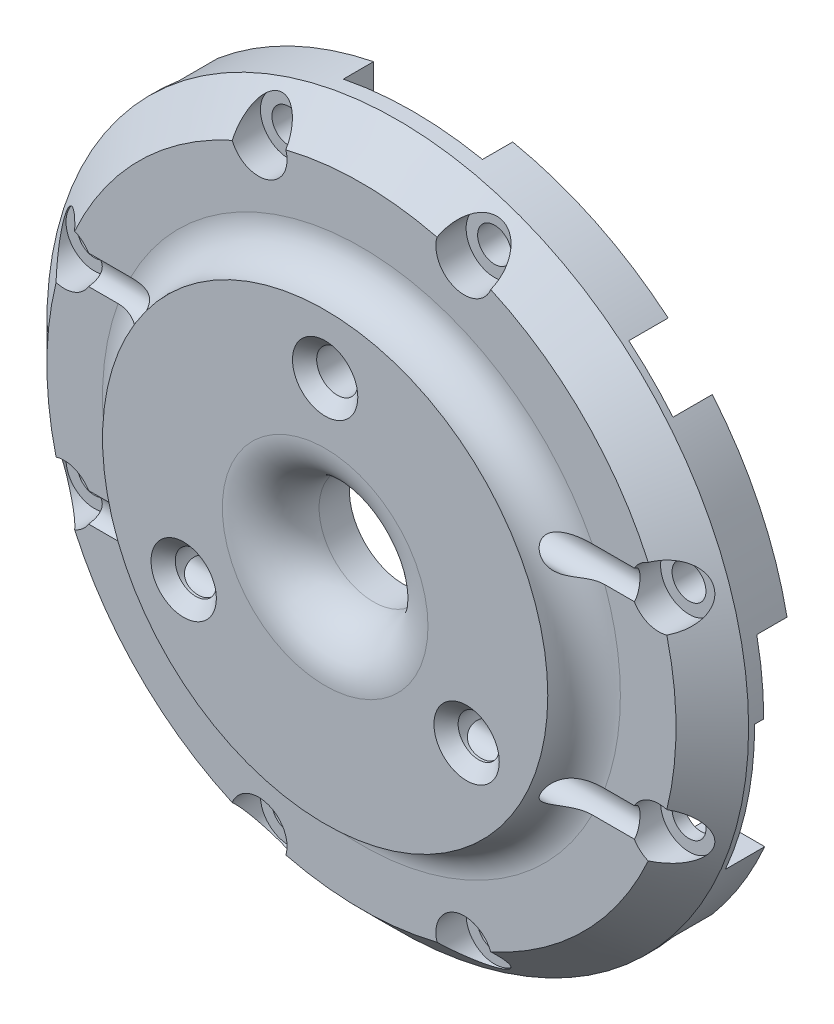
from build123d import *

# Parameters (mm, degrees)
SKETCH1_R               = 29
BOSS_EXTRUDE1_DEPTH     = 6.75
SKETCH3_W               = 44.5
SKETCH3_H               = 44.5
CUT_EXTRUDE1_DEPTH      = 3.25
SKETCH4_R               = 18.4
BOSS_EXTRUDE2_DEPTH     = 3
FILLET1_R               = 3
SKETCH5_R               = 1.7
CUT_EXTRUDE2_DEPTH      = 43.155219131
SKETCH7_R               = 3.25
CUT_EXTRUDE3_DEPTH      = 2
CHAMFER2_SIZE           = 3
CUT_EXTRUDE5_DEPTH      = 43.155219131
CUT_EXTRUDE5_DEPTH_BACK = 43.155219131
SKETCH9_R               = 1.3
SKETCH10_W              = 11.5
SKETCH10_H              = 12.03351403
SKETCH10_W_2            = 12.03351403
SKETCH10_H_2            = 11.5
CUT_EXTRUDE6_DEPTH      = 2.5
SKETCH11_R              = 1.4
CUT_EXTRUDE7_DEPTH      = 43.155219292
SKETCH12_R              = 2.35
CUT_EXTRUDE8_DEPTH      = 2.5
SKETCH13_W              = 6.5
SKETCH13_H              = 6.5
CUT_EXTRUDE9_DEPTH      = 2.25
SKETCH14_W              = 15.887507813
SKETCH14_H              = 11.6
CUT_EXTRUDE10_DEPTH     = 3.25
FILLET2_R               = 1.5
SKETCH16_R              = 4.5
CUT_EXTRUDE11_DEPTH     = 43.155219269
FILLET3_R               = 4
CHAMFER6_SIZE           = 1


# Some blends are built 0.0001 mm under size
with BuildPart() as part:
    # Sketch1 → Boss-Extrude1 (new body)
    with BuildSketch(Plane.XY):
        Circle(SKETCH1_R)
    extrude(amount=BOSS_EXTRUDE1_DEPTH)

    # Sketch3 → Cut-Extrude1 (cut)
    with BuildSketch(Plane(origin=(0, 0, 0), x_dir=(-1, 0, 0), z_dir=(0, 0, -1))):
        Rectangle(SKETCH3_W, SKETCH3_H)
    extrude(amount=-CUT_EXTRUDE1_DEPTH, mode=Mode.SUBTRACT)

    # Sketch4 → Boss-Extrude2 (add)
    with BuildSketch(Plane.XY.offset(6.75)):
        Circle(SKETCH4_R)
    extrude(amount=BOSS_EXTRUDE2_DEPTH)

    # Fillet1
    fillet1_edges = [part.edges().sort_by_distance(p)[0] for p in [
        (-18.4, 0, 6.75),
    ]]
    fillet(fillet1_edges, radius=FILLET1_R - 0.0001)  # a hair under: the kernel refuses the full size

    # Sketch5 → Cut-Extrude2 (cut, through all)
    with BuildSketch(Plane.XY.offset(9.75)):
        with Locations((0, 13.5)):
            Circle(SKETCH5_R)
        with Locations((11.691342951, -6.75)):
            Circle(SKETCH5_R)
        with Locations((-11.691342951, -6.75)):
            Circle(SKETCH5_R)
    extrude(amount=-CUT_EXTRUDE2_DEPTH, mode=Mode.SUBTRACT)

    # Sketch7 → Cut-Extrude3 (cut)
    with BuildSketch(Plane(origin=(0, 0, 3.25), x_dir=(-1, 0, 0), z_dir=(0, 0, -1))):
        with Locations((-11.691342951, -6.75)):
            Circle(SKETCH7_R)
        with Locations((11.691342951, -6.75)):
            Circle(SKETCH7_R)
        with Locations((0, 13.5)):
            Circle(SKETCH7_R)
    extrude(amount=-CUT_EXTRUDE3_DEPTH, mode=Mode.SUBTRACT)

    # Chamfer2
    chamfer2_edges = [part.edges().sort_by_distance(p)[0] for p in [
        (-29, 0, 6.75),
    ]]
    chamfer(chamfer2_edges, length=CHAMFER2_SIZE)

    # Sketch9 → Cut-Extrude5 (cut, two sides: drawn at the far end of the back side and taken through both)
    with BuildSketch(Plane(origin=(0, 0, 0), x_dir=(0, 0, -1), z_dir=(1, 0, 0)).offset(-CUT_EXTRUDE5_DEPTH_BACK)):
        with Locations(Location((-7.25, 8.5, 0), (0, 0, 67.380135052))):
            Circle(SKETCH9_R)
        with Locations(Location((-7.25, -8.5, 0), (0, 0, 292.619864948))):
            Circle(SKETCH9_R)
    extrude(amount=CUT_EXTRUDE5_DEPTH + CUT_EXTRUDE5_DEPTH_BACK, mode=Mode.SUBTRACT)

    # Sketch10 → Cut-Extrude6 (cut)
    with BuildSketch(Plane(origin=(0, 0, 0), x_dir=(-1, 0, 0), z_dir=(0, 0, -1))):
        with Locations((0, -28.01742408)):
            Rectangle(SKETCH10_W, SKETCH10_H)
        with Locations((28.01742408, 0)):
            Rectangle(SKETCH10_W_2, SKETCH10_H_2)
        with Locations((-28.01742408, 0)):
            Rectangle(SKETCH10_W_2, SKETCH10_H_2)
        with Locations((0, 28.01742408)):
            Rectangle(SKETCH10_W, SKETCH10_H)
    extrude(amount=-CUT_EXTRUDE6_DEPTH, mode=Mode.SUBTRACT)

    # Sketch11 → Cut-Extrude7 (cut, through all)
    with BuildSketch(Plane(origin=(0, 0, 0), x_dir=(-1, 0, 0), z_dir=(0, 0, -1))):
        with Locations((-24.571324751, 8.5)):
            Circle(SKETCH11_R)
        with Locations(Location((-24.571324751, -8.5, 0), (0, 0, 301.002719134))):
            Circle(SKETCH11_R)
        with Locations(Location((-8.5, 24.571324751, 0), (0, 0, 17.539359707))):
            Circle(SKETCH11_R)
        with Locations((8.5, 24.571324751)):
            Circle(SKETCH11_R)
        with Locations(Location((24.571324751, 8.5, 0), (0, 0, 287.539359707))):
            Circle(SKETCH11_R)
        with Locations((24.571324751, -8.5)):
            Circle(SKETCH11_R)
        with Locations(Location((8.5, -24.571324751, 0), (0, 0, 20.624890048))):
            Circle(SKETCH11_R)
        with Locations((-8.5, -24.571324751)):
            Circle(SKETCH11_R)
    extrude(amount=-CUT_EXTRUDE7_DEPTH, mode=Mode.SUBTRACT)

    # Sketch12 → Cut-Extrude8 (cut)
    with BuildSketch(Plane.XY.offset(6.75)):
        with Locations((-24.571324751, 8.5)):
            Circle(SKETCH12_R)
        with Locations((-24.571324751, -8.5)):
            Circle(SKETCH12_R)
        with Locations((8.5, 24.571324751)):
            Circle(SKETCH12_R)
        with Locations((-8.5, 24.571324751)):
            Circle(SKETCH12_R)
        with Locations((24.571324751, -8.5)):
            Circle(SKETCH12_R)
        with Locations((24.571324751, 8.5)):
            Circle(SKETCH12_R)
        with Locations((-8.5, -24.571324751)):
            Circle(SKETCH12_R)
        with Locations((8.5, -24.571324751)):
            Circle(SKETCH12_R)
    extrude(amount=-CUT_EXTRUDE8_DEPTH, mode=Mode.SUBTRACT)

    # Sketch13 → Cut-Extrude9 (cut)
    with BuildSketch(Plane(origin=(0, 0, 3.25), x_dir=(-1, 0, 0), z_dir=(0, 0, -1))):
        with Locations((-18.9, 11.5)):
            Rectangle(SKETCH13_W, SKETCH13_H)
        with Locations((11.5, 18.9)):
            Rectangle(SKETCH13_W, SKETCH13_H)
        with Locations((18.9, -11.5)):
            Rectangle(SKETCH13_W, SKETCH13_H)
        with Locations((-11.5, -18.9)):
            Rectangle(SKETCH13_W, SKETCH13_H)
    extrude(amount=-CUT_EXTRUDE9_DEPTH, mode=Mode.SUBTRACT)

    # Chamfer5
    # the kernel refuses this chamfer: 1 mm, written as the material it takes off along each edge
    with BuildSketch(Plane(origin=(15.65, 8.25, 3.25), x_dir=(0, -0.9996219169112968, -0.027495876610586487), z_dir=(1, 0, 0)), Plane(origin=(15.65, 14.75, 3.25), x_dir=(-0.9996219169112968, 0, -0.02749587661058651), z_dir=(0, -1, 0)), Plane(origin=(22.15, 14.75, 3.25), x_dir=(0, 0.9996219169112968, -0.02749587661058651), z_dir=(-1, 0, 0)), Plane(origin=(-8.25, 15.65, 3.25), x_dir=(0.9996219169112968, 0, -0.027495876610586487), z_dir=(0, 1, 0)), Plane(origin=(-14.75, 15.65, 3.25), x_dir=(0, -0.9996219169112968, -0.02749587661058651), z_dir=(1, 0, 0)), Plane(origin=(-14.75, 22.15, 3.25), x_dir=(-0.9996219169112968, 0, -0.02749587661058651), z_dir=(0, -1, 0)), Plane(origin=(-15.65, -8.25, 3.25), x_dir=(0, 0.9996219169112968, -0.027495876610586487), z_dir=(-1, 0, 0)), Plane(origin=(-15.65, -14.75, 3.25), x_dir=(0.9996219169112968, 0, -0.02749587661058651), z_dir=(0, 1, 0)), Plane(origin=(-22.15, -14.75, 3.25), x_dir=(0, -0.9996219169112968, -0.02749587661058651), z_dir=(1, 0, 0)), Plane(origin=(8.25, -15.65, 3.25), x_dir=(-0.9996219169112968, 0, -0.027495876610586487), z_dir=(0, -1, 0)), Plane(origin=(14.75, -15.65, 3.25), x_dir=(0, 0.9996219169112968, -0.02749587661058651), z_dir=(-1, 0, 0)), Plane(origin=(14.75, -22.15, 3.25), x_dir=(0.9996219169112968, 0, -0.02749587661058651), z_dir=(0, 1, 0))) as chamfer5_piece_1:
        with BuildLine():
            Line((1.028673195, 0), (-0.056547155, -1.027117794))
            Line((-0.056547155, -1.027117794), (-0.076539593, -1.026567876))
            ThreePointArc((-0.076539593, -1.026567876), (-0.034129227, -0.51339783), (-0.019992438, 0.000549918))
            Line((-0.019992438, 0.000549918), (0.000549918, 0.019992438))
            ThreePointArc((0.000549918, 0.019992438), (0.514497665, 0.00585565), (1.029223113, 0.019992438))
            Line((1.029223113, 0.019992438), (1.028673195, 0))
        make_face()
    extrude(amount=6.5, mode=Mode.SUBTRACT)
    with BuildSketch(Plane(origin=(13.078317012, 8.25, 3.25), x_dir=(0, -0.9996219169112968, -0.027495876610586487), z_dir=(1, 0, 0))) as chamfer5_piece_2a_section:
        with BuildLine():
            Line((1.028673195, 0), (-0.056547155, -1.027117794))
            Line((-0.056547155, -1.027117794), (-0.076539593, -1.026567876))
            ThreePointArc((-0.076539593, -1.026567876), (-0.034129227, -0.51339783), (-0.019992438, 0.000549918))
            Line((-0.019992438, 0.000549918), (0.000549918, 0.019992438))
            ThreePointArc((0.000549918, 0.019992438), (0.514497665, 0.00585565), (1.029223113, 0.019992438))
            Line((1.029223113, 0.019992438), (1.028673195, 0))
        make_face()
    chamfer5_piece_2a = extrude(amount=9.071682988, mode=Mode.PRIVATE)
    chamfer5_piece_2a = split(chamfer5_piece_2a, bisect_by=Plane(origin=(15.65, 7.920206373, 3.579793627), z_dir=(-1, 0, 0)), keep=Keep.TOP, mode=Mode.PRIVATE)
    with BuildSketch(Plane(origin=(15.65, 14.75, 3.25), x_dir=(-0.9996219169112968, 0, -0.02749587661058651), z_dir=(0, -1, 0))) as chamfer5_piece_2b_section:
        with BuildLine():
            Line((1.028673195, 0), (-0.056547155, -1.027117794))
            Line((-0.056547155, -1.027117794), (-0.076539593, -1.026567876))
            ThreePointArc((-0.076539593, -1.026567876), (-0.034129227, -0.51339783), (-0.019992438, 0.000549918))
            Line((-0.019992438, 0.000549918), (0.000549918, 0.019992438))
            ThreePointArc((0.000549918, 0.019992438), (0.514497665, 0.00585565), (1.029223113, 0.019992438))
            Line((1.029223113, 0.019992438), (1.028673195, 0))
        make_face()
    chamfer5_piece_2b = extrude(amount=9.071682988, mode=Mode.PRIVATE)
    chamfer5_piece_2b = split(chamfer5_piece_2b, bisect_by=Plane(origin=(15.320206373, 8.25, 3.579793627), z_dir=(0, -1, 0)), keep=Keep.TOP, mode=Mode.PRIVATE)
    chamfer5_piece_2 = chamfer5_piece_2a & chamfer5_piece_2b
    add(chamfer5_piece_2, mode=Mode.SUBTRACT)
    with BuildSketch(Plane(origin=(15.65, 17.321682988, 3.25), x_dir=(-0.9996219169112968, 0, -0.02749587661058651), z_dir=(0, -1, 0))) as chamfer5_piece_3a_section:
        with BuildLine():
            Line((1.028673195, 0), (-0.056547155, -1.027117794))
            Line((-0.056547155, -1.027117794), (-0.076539593, -1.026567876))
            ThreePointArc((-0.076539593, -1.026567876), (-0.034129227, -0.51339783), (-0.019992438, 0.000549918))
            Line((-0.019992438, 0.000549918), (0.000549918, 0.019992438))
            ThreePointArc((0.000549918, 0.019992438), (0.514497665, 0.00585565), (1.029223113, 0.019992438))
            Line((1.029223113, 0.019992438), (1.028673195, 0))
        make_face()
    chamfer5_piece_3a = extrude(amount=9.071682988, mode=Mode.PRIVATE)
    chamfer5_piece_3a = split(chamfer5_piece_3a, bisect_by=Plane(origin=(15.320206373, 14.75, 3.579793627), z_dir=(0, 1, 0)), keep=Keep.TOP, mode=Mode.PRIVATE)
    with BuildSketch(Plane(origin=(22.15, 14.75, 3.25), x_dir=(0, 0.9996219169112968, -0.02749587661058651), z_dir=(-1, 0, 0))) as chamfer5_piece_3b_section:
        with BuildLine():
            Line((1.028673195, 0), (-0.056547155, -1.027117794))
            Line((-0.056547155, -1.027117794), (-0.076539593, -1.026567876))
            ThreePointArc((-0.076539593, -1.026567876), (-0.034129227, -0.51339783), (-0.019992438, 0.000549918))
            Line((-0.019992438, 0.000549918), (0.000549918, 0.019992438))
            ThreePointArc((0.000549918, 0.019992438), (0.514497665, 0.00585565), (1.029223113, 0.019992438))
            Line((1.029223113, 0.019992438), (1.028673195, 0))
        make_face()
    chamfer5_piece_3b = extrude(amount=9.071682988, mode=Mode.PRIVATE)
    chamfer5_piece_3b = split(chamfer5_piece_3b, bisect_by=Plane(origin=(15.65, 15.079793627, 3.579793627), z_dir=(-1, 0, 0)), keep=Keep.TOP, mode=Mode.PRIVATE)
    chamfer5_piece_3 = chamfer5_piece_3a & chamfer5_piece_3b
    add(chamfer5_piece_3, mode=Mode.SUBTRACT)
    with BuildSketch(Plane(origin=(-8.25, 13.078317012, 3.25), x_dir=(0.9996219169112968, 0, -0.027495876610586487), z_dir=(0, 1, 0))) as chamfer5_piece_4a_section:
        with BuildLine():
            Line((1.028673195, 0), (-0.056547155, -1.027117794))
            Line((-0.056547155, -1.027117794), (-0.076539593, -1.026567876))
            ThreePointArc((-0.076539593, -1.026567876), (-0.034129227, -0.51339783), (-0.019992438, 0.000549918))
            Line((-0.019992438, 0.000549918), (0.000549918, 0.019992438))
            ThreePointArc((0.000549918, 0.019992438), (0.514497665, 0.00585565), (1.029223113, 0.019992438))
            Line((1.029223113, 0.019992438), (1.028673195, 0))
        make_face()
    chamfer5_piece_4a = extrude(amount=9.071682988, mode=Mode.PRIVATE)
    chamfer5_piece_4a = split(chamfer5_piece_4a, bisect_by=Plane(origin=(-7.920206373, 15.65, 3.579793627), z_dir=(0, -1, 0)), keep=Keep.TOP, mode=Mode.PRIVATE)
    with BuildSketch(Plane(origin=(-14.75, 15.65, 3.25), x_dir=(0, -0.9996219169112968, -0.02749587661058651), z_dir=(1, 0, 0))) as chamfer5_piece_4b_section:
        with BuildLine():
            Line((1.028673195, 0), (-0.056547155, -1.027117794))
            Line((-0.056547155, -1.027117794), (-0.076539593, -1.026567876))
            ThreePointArc((-0.076539593, -1.026567876), (-0.034129227, -0.51339783), (-0.019992438, 0.000549918))
            Line((-0.019992438, 0.000549918), (0.000549918, 0.019992438))
            ThreePointArc((0.000549918, 0.019992438), (0.514497665, 0.00585565), (1.029223113, 0.019992438))
            Line((1.029223113, 0.019992438), (1.028673195, 0))
        make_face()
    chamfer5_piece_4b = extrude(amount=9.071682988, mode=Mode.PRIVATE)
    chamfer5_piece_4b = split(chamfer5_piece_4b, bisect_by=Plane(origin=(-8.25, 15.320206373, 3.579793627), z_dir=(1, 0, 0)), keep=Keep.TOP, mode=Mode.PRIVATE)
    chamfer5_piece_4 = chamfer5_piece_4a & chamfer5_piece_4b
    add(chamfer5_piece_4, mode=Mode.SUBTRACT)
    with BuildSketch(Plane(origin=(-17.321682988, 15.65, 3.25), x_dir=(0, -0.9996219169112968, -0.02749587661058651), z_dir=(1, 0, 0))) as chamfer5_piece_5a_section:
        with BuildLine():
            Line((1.028673195, 0), (-0.056547155, -1.027117794))
            Line((-0.056547155, -1.027117794), (-0.076539593, -1.026567876))
            ThreePointArc((-0.076539593, -1.026567876), (-0.034129227, -0.51339783), (-0.019992438, 0.000549918))
            Line((-0.019992438, 0.000549918), (0.000549918, 0.019992438))
            ThreePointArc((0.000549918, 0.019992438), (0.514497665, 0.00585565), (1.029223113, 0.019992438))
            Line((1.029223113, 0.019992438), (1.028673195, 0))
        make_face()
    chamfer5_piece_5a = extrude(amount=9.071682988, mode=Mode.PRIVATE)
    chamfer5_piece_5a = split(chamfer5_piece_5a, bisect_by=Plane(origin=(-14.75, 15.320206373, 3.579793627), z_dir=(-1, 0, 0)), keep=Keep.TOP, mode=Mode.PRIVATE)
    with BuildSketch(Plane(origin=(-14.75, 22.15, 3.25), x_dir=(-0.9996219169112968, 0, -0.02749587661058651), z_dir=(0, -1, 0))) as chamfer5_piece_5b_section:
        with BuildLine():
            Line((1.028673195, 0), (-0.056547155, -1.027117794))
            Line((-0.056547155, -1.027117794), (-0.076539593, -1.026567876))
            ThreePointArc((-0.076539593, -1.026567876), (-0.034129227, -0.51339783), (-0.019992438, 0.000549918))
            Line((-0.019992438, 0.000549918), (0.000549918, 0.019992438))
            ThreePointArc((0.000549918, 0.019992438), (0.514497665, 0.00585565), (1.029223113, 0.019992438))
            Line((1.029223113, 0.019992438), (1.028673195, 0))
        make_face()
    chamfer5_piece_5b = extrude(amount=9.071682988, mode=Mode.PRIVATE)
    chamfer5_piece_5b = split(chamfer5_piece_5b, bisect_by=Plane(origin=(-15.079793627, 15.65, 3.579793627), z_dir=(0, -1, 0)), keep=Keep.TOP, mode=Mode.PRIVATE)
    chamfer5_piece_5 = chamfer5_piece_5a & chamfer5_piece_5b
    add(chamfer5_piece_5, mode=Mode.SUBTRACT)
    with BuildSketch(Plane(origin=(-13.078317012, -8.25, 3.25), x_dir=(0, 0.9996219169112968, -0.027495876610586487), z_dir=(-1, 0, 0))) as chamfer5_piece_6a_section:
        with BuildLine():
            Line((1.028673195, 0), (-0.056547155, -1.027117794))
            Line((-0.056547155, -1.027117794), (-0.076539593, -1.026567876))
            ThreePointArc((-0.076539593, -1.026567876), (-0.034129227, -0.51339783), (-0.019992438, 0.000549918))
            Line((-0.019992438, 0.000549918), (0.000549918, 0.019992438))
            ThreePointArc((0.000549918, 0.019992438), (0.514497665, 0.00585565), (1.029223113, 0.019992438))
            Line((1.029223113, 0.019992438), (1.028673195, 0))
        make_face()
    chamfer5_piece_6a = extrude(amount=9.071682988, mode=Mode.PRIVATE)
    chamfer5_piece_6a = split(chamfer5_piece_6a, bisect_by=Plane(origin=(-15.65, -7.920206373, 3.579793627), z_dir=(1, 0, 0)), keep=Keep.TOP, mode=Mode.PRIVATE)
    with BuildSketch(Plane(origin=(-15.65, -14.75, 3.25), x_dir=(0.9996219169112968, 0, -0.02749587661058651), z_dir=(0, 1, 0))) as chamfer5_piece_6b_section:
        with BuildLine():
            Line((1.028673195, 0), (-0.056547155, -1.027117794))
            Line((-0.056547155, -1.027117794), (-0.076539593, -1.026567876))
            ThreePointArc((-0.076539593, -1.026567876), (-0.034129227, -0.51339783), (-0.019992438, 0.000549918))
            Line((-0.019992438, 0.000549918), (0.000549918, 0.019992438))
            ThreePointArc((0.000549918, 0.019992438), (0.514497665, 0.00585565), (1.029223113, 0.019992438))
            Line((1.029223113, 0.019992438), (1.028673195, 0))
        make_face()
    chamfer5_piece_6b = extrude(amount=9.071682988, mode=Mode.PRIVATE)
    chamfer5_piece_6b = split(chamfer5_piece_6b, bisect_by=Plane(origin=(-15.320206373, -8.25, 3.579793627), z_dir=(0, 1, 0)), keep=Keep.TOP, mode=Mode.PRIVATE)
    chamfer5_piece_6 = chamfer5_piece_6a & chamfer5_piece_6b
    add(chamfer5_piece_6, mode=Mode.SUBTRACT)
    with BuildSketch(Plane(origin=(-15.65, -17.321682988, 3.25), x_dir=(0.9996219169112968, 0, -0.02749587661058651), z_dir=(0, 1, 0))) as chamfer5_piece_7a_section:
        with BuildLine():
            Line((1.028673195, 0), (-0.056547155, -1.027117794))
            Line((-0.056547155, -1.027117794), (-0.076539593, -1.026567876))
            ThreePointArc((-0.076539593, -1.026567876), (-0.034129227, -0.51339783), (-0.019992438, 0.000549918))
            Line((-0.019992438, 0.000549918), (0.000549918, 0.019992438))
            ThreePointArc((0.000549918, 0.019992438), (0.514497665, 0.00585565), (1.029223113, 0.019992438))
            Line((1.029223113, 0.019992438), (1.028673195, 0))
        make_face()
    chamfer5_piece_7a = extrude(amount=9.071682988, mode=Mode.PRIVATE)
    chamfer5_piece_7a = split(chamfer5_piece_7a, bisect_by=Plane(origin=(-15.320206373, -14.75, 3.579793627), z_dir=(0, -1, 0)), keep=Keep.TOP, mode=Mode.PRIVATE)
    with BuildSketch(Plane(origin=(-22.15, -14.75, 3.25), x_dir=(0, -0.9996219169112968, -0.02749587661058651), z_dir=(1, 0, 0))) as chamfer5_piece_7b_section:
        with BuildLine():
            Line((1.028673195, 0), (-0.056547155, -1.027117794))
            Line((-0.056547155, -1.027117794), (-0.076539593, -1.026567876))
            ThreePointArc((-0.076539593, -1.026567876), (-0.034129227, -0.51339783), (-0.019992438, 0.000549918))
            Line((-0.019992438, 0.000549918), (0.000549918, 0.019992438))
            ThreePointArc((0.000549918, 0.019992438), (0.514497665, 0.00585565), (1.029223113, 0.019992438))
            Line((1.029223113, 0.019992438), (1.028673195, 0))
        make_face()
    chamfer5_piece_7b = extrude(amount=9.071682988, mode=Mode.PRIVATE)
    chamfer5_piece_7b = split(chamfer5_piece_7b, bisect_by=Plane(origin=(-15.65, -15.079793627, 3.579793627), z_dir=(1, 0, 0)), keep=Keep.TOP, mode=Mode.PRIVATE)
    chamfer5_piece_7 = chamfer5_piece_7a & chamfer5_piece_7b
    add(chamfer5_piece_7, mode=Mode.SUBTRACT)
    with BuildSketch(Plane(origin=(8.25, -13.078317012, 3.25), x_dir=(-0.9996219169112968, 0, -0.027495876610586487), z_dir=(0, -1, 0))) as chamfer5_piece_8a_section:
        with BuildLine():
            Line((1.028673195, 0), (-0.056547155, -1.027117794))
            Line((-0.056547155, -1.027117794), (-0.076539593, -1.026567876))
            ThreePointArc((-0.076539593, -1.026567876), (-0.034129227, -0.51339783), (-0.019992438, 0.000549918))
            Line((-0.019992438, 0.000549918), (0.000549918, 0.019992438))
            ThreePointArc((0.000549918, 0.019992438), (0.514497665, 0.00585565), (1.029223113, 0.019992438))
            Line((1.029223113, 0.019992438), (1.028673195, 0))
        make_face()
    chamfer5_piece_8a = extrude(amount=9.071682988, mode=Mode.PRIVATE)
    chamfer5_piece_8a = split(chamfer5_piece_8a, bisect_by=Plane(origin=(7.920206373, -15.65, 3.579793627), z_dir=(0, 1, 0)), keep=Keep.TOP, mode=Mode.PRIVATE)
    with BuildSketch(Plane(origin=(14.75, -15.65, 3.25), x_dir=(0, 0.9996219169112968, -0.02749587661058651), z_dir=(-1, 0, 0))) as chamfer5_piece_8b_section:
        with BuildLine():
            Line((1.028673195, 0), (-0.056547155, -1.027117794))
            Line((-0.056547155, -1.027117794), (-0.076539593, -1.026567876))
            ThreePointArc((-0.076539593, -1.026567876), (-0.034129227, -0.51339783), (-0.019992438, 0.000549918))
            Line((-0.019992438, 0.000549918), (0.000549918, 0.019992438))
            ThreePointArc((0.000549918, 0.019992438), (0.514497665, 0.00585565), (1.029223113, 0.019992438))
            Line((1.029223113, 0.019992438), (1.028673195, 0))
        make_face()
    chamfer5_piece_8b = extrude(amount=9.071682988, mode=Mode.PRIVATE)
    chamfer5_piece_8b = split(chamfer5_piece_8b, bisect_by=Plane(origin=(8.25, -15.320206373, 3.579793627), z_dir=(-1, 0, 0)), keep=Keep.TOP, mode=Mode.PRIVATE)
    chamfer5_piece_8 = chamfer5_piece_8a & chamfer5_piece_8b
    add(chamfer5_piece_8, mode=Mode.SUBTRACT)
    with BuildSketch(Plane(origin=(17.321682988, -15.65, 3.25), x_dir=(0, 0.9996219169112968, -0.02749587661058651), z_dir=(-1, 0, 0))) as chamfer5_piece_9a_section:
        with BuildLine():
            Line((1.028673195, 0), (-0.056547155, -1.027117794))
            Line((-0.056547155, -1.027117794), (-0.076539593, -1.026567876))
            ThreePointArc((-0.076539593, -1.026567876), (-0.034129227, -0.51339783), (-0.019992438, 0.000549918))
            Line((-0.019992438, 0.000549918), (0.000549918, 0.019992438))
            ThreePointArc((0.000549918, 0.019992438), (0.514497665, 0.00585565), (1.029223113, 0.019992438))
            Line((1.029223113, 0.019992438), (1.028673195, 0))
        make_face()
    chamfer5_piece_9a = extrude(amount=9.071682988, mode=Mode.PRIVATE)
    chamfer5_piece_9a = split(chamfer5_piece_9a, bisect_by=Plane(origin=(14.75, -15.320206373, 3.579793627), z_dir=(1, 0, 0)), keep=Keep.TOP, mode=Mode.PRIVATE)
    with BuildSketch(Plane(origin=(14.75, -22.15, 3.25), x_dir=(0.9996219169112968, 0, -0.02749587661058651), z_dir=(0, 1, 0))) as chamfer5_piece_9b_section:
        with BuildLine():
            Line((1.028673195, 0), (-0.056547155, -1.027117794))
            Line((-0.056547155, -1.027117794), (-0.076539593, -1.026567876))
            ThreePointArc((-0.076539593, -1.026567876), (-0.034129227, -0.51339783), (-0.019992438, 0.000549918))
            Line((-0.019992438, 0.000549918), (0.000549918, 0.019992438))
            ThreePointArc((0.000549918, 0.019992438), (0.514497665, 0.00585565), (1.029223113, 0.019992438))
            Line((1.029223113, 0.019992438), (1.028673195, 0))
        make_face()
    chamfer5_piece_9b = extrude(amount=9.071682988, mode=Mode.PRIVATE)
    chamfer5_piece_9b = split(chamfer5_piece_9b, bisect_by=Plane(origin=(15.079793627, -15.65, 3.579793627), z_dir=(0, 1, 0)), keep=Keep.TOP, mode=Mode.PRIVATE)
    chamfer5_piece_9 = chamfer5_piece_9a & chamfer5_piece_9b
    add(chamfer5_piece_9, mode=Mode.SUBTRACT)

    # Sketch14 → Cut-Extrude10 (cut)
    with BuildSketch(Plane(origin=(0, 0, 0), x_dir=(-1, 0, 0), z_dir=(0, 0, -1))):
        with Locations((-27.176000206, -5.8)):
            Rectangle(SKETCH14_W, SKETCH14_H)
    extrude(amount=-CUT_EXTRUDE10_DEPTH, mode=Mode.SUBTRACT)

    # Fillet2
    # the kernel refuses this fillet: 1.5 mm, written as the material it takes off along each edge
    with BuildSketch(Plane(origin=(-11.691342951, -6.75, 3.25), x_dir=(-1, 0, 0), z_dir=(0, -1, 0))) as fillet2_piece_1:
        with BuildLine():
            CenterArc((3.25 + FILLET2_R, -FILLET2_R), FILLET2_R, 90, 90)
            Line((3.25, -FILLET2_R), (3.25, 0))
            Line((3.25, 0), (3.25 + FILLET2_R, 0))
        make_face()
    revolve(axis=Axis((-11.691342951, -6.75, 3.25), (0, 0, -1)), revolution_arc=359.64, mode=Mode.SUBTRACT)
    with BuildSketch(Plane(origin=(11.691342951, -6.75, 3.25), x_dir=(-1, 0, 0), z_dir=(0, -1, 0))) as fillet2_piece_2:
        with BuildLine():
            CenterArc((3.25 + FILLET2_R, -FILLET2_R), FILLET2_R, 90, 90)
            Line((3.25, -FILLET2_R), (3.25, 0))
            Line((3.25, 0), (3.25 + FILLET2_R, 0))
        make_face()
    revolve(axis=Axis((11.691342951, -6.75, 3.25), (0, 0, -1)), mode=Mode.SUBTRACT)
    with BuildSketch(Plane(origin=(0, 13.5, 3.25), x_dir=(-1, 0, 0), z_dir=(0, -1, 0))) as fillet2_piece_3:
        with BuildLine():
            CenterArc((3.25 + FILLET2_R, -FILLET2_R), FILLET2_R, 90, 90)
            Line((3.25, -FILLET2_R), (3.25, 0))
            Line((3.25, 0), (3.25 + FILLET2_R, 0))
        make_face()
    revolve(axis=Axis((0, 13.5, 3.25), (0, 0, -1)), mode=Mode.SUBTRACT)
    with BuildSketch(Plane(origin=(-11.691342951, -6.75, 3.25), x_dir=(-0.2594822912336791, -0.9657478659236686, 0), z_dir=(0.9657478659236686, -0.2594822912336791, 0))) as fillet2_piece_4:
        with BuildLine():
            CenterArc((3.25 + FILLET2_R, -FILLET2_R), FILLET2_R, 90, 90)
            Line((3.25, -FILLET2_R), (3.25, 0))
            Line((3.25, 0), (3.25 + FILLET2_R, 0))
        make_face()
    revolve(axis=Axis((-11.691342951, -6.75, 3.25), (0, 0, -1)), revolution_arc=74.960654636, mode=Mode.SUBTRACT)

    # Sketch16 → Cut-Extrude11 (cut, through all)
    with BuildSketch(Plane.XY.offset(9.75)):
        Circle(SKETCH16_R)
    extrude(amount=-CUT_EXTRUDE11_DEPTH, mode=Mode.SUBTRACT)

    # Fillet3
    fillet3_edges = [part.edges().sort_by_distance(p)[0] for p in [
        (-4.5, 0, 9.75),
    ]]
    fillet(fillet3_edges, radius=FILLET3_R)

    # Chamfer6
    chamfer6_edges = [part.edges().sort_by_distance(p)[0] for p in [
        (9.991342951, -6.75, 9.75),
        (-1.7, 13.5, 9.75),
        (-13.391342951, -6.75, 9.75),
    ]]
    chamfer(chamfer6_edges, length=CHAMFER6_SIZE)


solid = part.part
